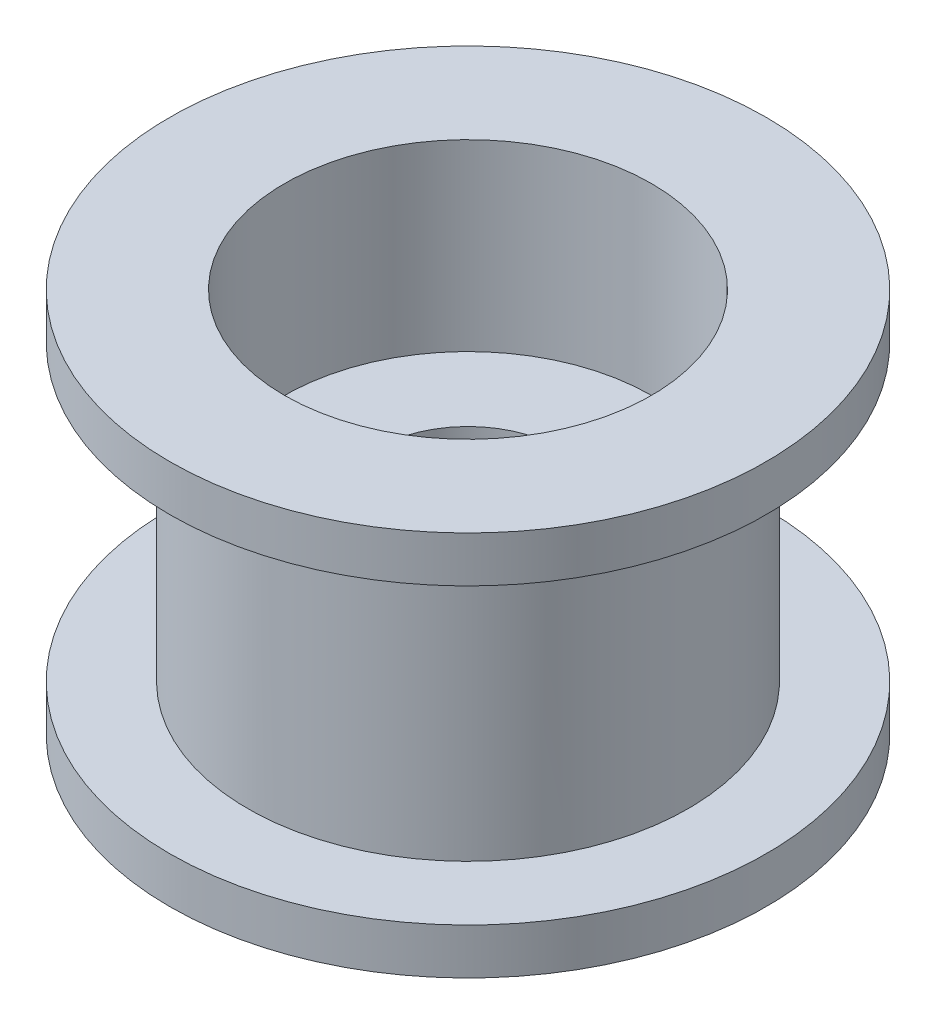
from build123d import *

# Parameters (mm, degrees)
BASES_R        = 4.8
BASE_DEPTH     = 3.2
FLANGES_R      = 6.5
FLANGE_DEPTH   = 1
TOPBORES_R     = 4
TOPBORE_DEPTH  = 4
THRUHOLES_R    = 2
THRUHOLE_DEPTH = 11.191172651


with BuildPart() as part:
    # BaseS → Base (new, symmetric)
    with BuildSketch(Plane(origin=(0, 0, 0), x_dir=(1, 0, 0), z_dir=(0, 1, 0))):
        Circle(BASES_R)
    extrude(amount=BASE_DEPTH, both=True)

    # FlangeS → Flange (add)
    with BuildSketch(Plane(origin=(0, 3.2, 0), x_dir=(1, 0, 0), z_dir=(0, 1, 0))):
        Circle(FLANGES_R)
    flange = extrude(amount=FLANGE_DEPTH)

    # TopBoreS → TopBore (cut)
    with BuildSketch(Plane(origin=(0, 4.2, 0), x_dir=(1, 0, 0), z_dir=(0, 1, 0))):
        Circle(TOPBORES_R)
    topbore = extrude(amount=-TOPBORE_DEPTH, mode=Mode.SUBTRACT)

    # BoreVM: Flange, TopBore across plane
    add(flange.mirror(Plane.ZX))
    add(topbore.mirror(Plane.ZX), mode=Mode.SUBTRACT)

    # ThruHoleS → ThruHole (cut, through all)
    with BuildSketch(Plane(origin=(0, 0.2, 0), x_dir=(1, 0, 0), z_dir=(0, 1, 0))):
        Circle(THRUHOLES_R)
    extrude(amount=-THRUHOLE_DEPTH, mode=Mode.SUBTRACT)


solid = part.part
